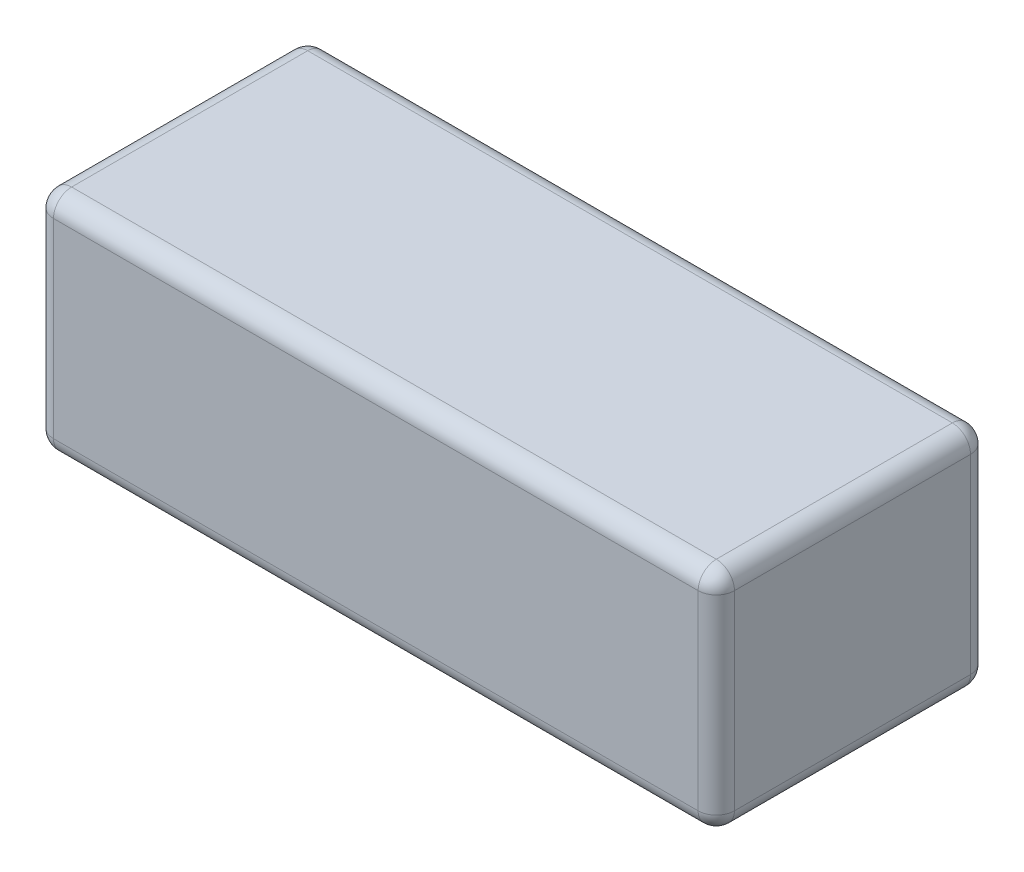
from build123d import *

# Parameters (mm, degrees)
SKETCH1_W           = 75
SKETCH1_H           = 30
BOSS_EXTRUDE1_DEPTH = 25
FILLET2_R           = 2
CUT_EXTRUDE1_DEPTH  = 1


with BuildPart() as part:
    # Sketch1 → Boss-Extrude1 (new body)
    with BuildSketch(Plane(origin=(0, 0, 0), x_dir=(1, 0, 0), z_dir=(0, 1, 0))):
        with Locations((0, -0.011554176)):
            Rectangle(SKETCH1_W, SKETCH1_H)
    extrude(amount=BOSS_EXTRUDE1_DEPTH)

    # Fillet2
    fillet2_edges = [part.edges().sort_by_distance(p)[0] for p in [
        (0, 25, -14.988445824),
        (-37.5, 12.5, -14.988445824),
        (-37.5, 25, 0.011554176),
        (0, 0, -14.988445824),
        (-37.5, 0, 0.011554176),
        (-37.5, 12.5, 15.011554176),
        (0, 25, 15.011554176),
        (0, 0, 15.011554176),
        (37.5, 12.5, 15.011554176),
        (37.5, 25, 0.011554176),
        (37.5, 12.5, -14.988445824),
        (37.5, 0, 0.011554176),
    ]]
    fillet(fillet2_edges, radius=FILLET2_R)

    # Sketch2 → Cut-Extrude1 (cut)
    # profile 1 of 14: a face of its own
    with BuildSketch(Plane.XZ):
        Polygon((-24.849242405, 0), (-17.424621202, 7.424621202), (-10, 0), (-17.424621202, -7.424621202), align=None)
    # profile 2 of 14: a face of its own
    with BuildSketch(Plane.XZ):
        with BuildLine():
            Line((-9.837179487, 3.224969952), (-9.300380609, 3.546794872))
            add(Edge.make_bspline(
                [(-9.300380609, 3.546794872), (-9.250454664, 3.463220916), (-9.154798481, 3.303096443), (-8.995229586, 3.086728284), (-8.829888448, 2.902828371), (-8.657550657, 2.752466525), (-8.479268151, 2.634086402), (-8.293877082, 2.550262353), (-8.102002197, 2.497981941), (-7.971421121, 2.491631784), (-7.906229968, 2.488461538)],
                knots=[0, 0, 0, 0, 1.272034388, 2.437168799, 3.508375237, 4.49857839, 5.41946034, 6.295179144, 7.148887113, 8, 8, 8, 8], degree=3))
            add(Edge.make_bspline(
                [(-7.906229968, 2.488461538), (-7.850555235, 2.490012159), (-7.740179947, 2.493086267), (-7.577688449, 2.522624293), (-7.419878608, 2.568003441), (-7.270002937, 2.632992846), (-7.130129464, 2.711621241), (-7.007471603, 2.806592163), (-6.901433655, 2.912920565), (-6.814694261, 3.031543381), (-6.748146197, 3.15911878), (-6.69699773, 3.290066577), (-6.668613097, 3.426443837), (-6.664337272, 3.518265676), (-6.662179487, 3.564603365)],
                knots=[0, 0, 0, 0, 1.095163259, 2.171163733, 3.241058638, 4.321873601, 5.38011039, 6.391990106, 7.366004449, 8.327778327, 9.272591725, 10.192022065, 11.087607919, 12, 12, 12, 12], degree=3))
            add(Edge.make_bspline(
                [(-6.662179487, 3.564603365), (-6.664854308, 3.617473193), (-6.670291828, 3.724949826), (-6.71625037, 3.883517768), (-6.78854829, 4.040440002), (-6.855246229, 4.137506584), (-6.889873798, 4.187900641)],
                knots=[0, 0, 0, 0, 0.938893495, 1.908633276, 2.914225137, 4, 4, 4, 4], degree=3))
            add(Edge.make_bspline(
                [(-6.889873798, 4.187900641), (-6.91830477, 4.224271307), (-6.977992038, 4.30062697), (-7.080603525, 4.414283326), (-7.201010618, 4.5315196), (-7.335092782, 4.65681246), (-7.487734243, 4.784334606), (-7.654154162, 4.920167053), (-7.838601449, 5.0591442), (-7.967959107, 5.152348712), (-8.034705529, 5.200440705)],
                knots=[0, 0, 0, 0, 0.722233717, 1.516239348, 2.393582979, 3.351407094, 4.387010283, 5.505090956, 6.712668013, 8, 8, 8, 8], degree=3))
            add(Edge.make_bspline(
                [(-8.034705529, 5.200440705), (-8.101514779, 5.248026857), (-8.229248978, 5.339007956), (-8.407880977, 5.474034871), (-8.567618789, 5.597485891), (-8.707752433, 5.71052317), (-8.828220273, 5.813162039), (-8.929971605, 5.904416871), (-9.010414415, 5.986755618), (-9.055146683, 6.040170623), (-9.075230369, 6.064152644)],
                knots=[0, 0, 0, 0, 1.452282411, 2.77665338, 3.964542531, 5.026858415, 5.96415736, 6.766646006, 7.446254459, 8, 8, 8, 8], degree=3))
            add(Edge.make_bspline(
                [(-9.075230369, 6.064152644), (-9.103301986, 6.101528811), (-9.15850859, 6.175034059), (-9.2313812, 6.289923444), (-9.293319395, 6.407531369), (-9.341873912, 6.528173866), (-9.382761052, 6.650157237), (-9.410261869, 6.775073068), (-9.427481975, 6.902360847), (-9.429245436, 6.988019627), (-9.430128205, 7.030899439)],
                knots=[0, 0, 0, 0, 1.068054152, 2.10047183, 3.106115577, 4.101338837, 5.06977816, 6.043150881, 7.020423561, 8, 8, 8, 8], degree=3))
            add(Edge.make_bspline(
                [(-9.430128205, 7.030899439), (-9.427760183, 7.09808203), (-9.423074754, 7.231011231), (-9.383449815, 7.425195738), (-9.320906137, 7.610591095), (-9.233285412, 7.785361843), (-9.120332786, 7.944957266), (-8.989620804, 8.091213164), (-8.83393425, 8.214164734), (-8.663114491, 8.321592326), (-8.476140787, 8.405677076), (-8.280214434, 8.469106283), (-8.075024032, 8.505045936), (-7.936044059, 8.510203524), (-7.86552484, 8.512820513)],
                knots=[0, 0, 0, 0, 1.005424448, 1.989358655, 2.955360095, 3.929531133, 4.905563448, 5.876582895, 6.856512386, 7.866279853, 8.892233794, 9.918561126, 10.94386622, 12, 12, 12, 12], degree=3))
            add(Edge.make_bspline(
                [(-7.86552484, 8.512820513), (-7.790696258, 8.510239598), (-7.641886091, 8.505106981), (-7.422993943, 8.460480032), (-7.212245214, 8.386637384), (-7.042712434, 8.302837962), (-6.91002871, 8.219142394), (-6.808841037, 8.142906427), (-6.706302234, 8.055140158), (-6.601585192, 7.955609812), (-6.496464281, 7.843402135), (-6.389378875, 7.719285599), (-6.280078558, 7.584018705), (-6.209764355, 7.487454254), (-6.173717949, 7.437950721)],
                knots=[0, 0, 0, 0, 1.286793592, 2.559021753, 3.825965368, 5.121522368, 5.803751409, 6.523245864, 7.299691795, 8.125521123, 9.008227632, 9.944561021, 10.946284179, 12, 12, 12, 12], degree=3))
            Line((-6.173717949, 7.437950721), (-6.688892228, 7.047435897))
            add(Edge.make_bspline(
                [(-6.688892228, 7.047435897), (-6.719999848, 7.087511093), (-6.779905851, 7.164686549), (-6.870855063, 7.272765936), (-6.95657761, 7.371492978), (-7.041033336, 7.457245424), (-7.119761781, 7.534719295), (-7.196174129, 7.601049139), (-7.269170738, 7.656884863), (-7.361185704, 7.716472464), (-7.476787851, 7.775539263), (-7.621902652, 7.825521162), (-7.773552037, 7.855556775), (-7.876838654, 7.859528042), (-7.929126603, 7.861538462)],
                knots=[0, 0, 0, 0, 1.181633172, 2.275549214, 3.290209073, 4.226197932, 5.078386478, 5.862611352, 6.581680152, 7.217281963, 8.414376989, 9.595101626, 10.782541182, 12, 12, 12, 12], degree=3))
            add(Edge.make_bspline(
                [(-7.929126603, 7.861538462), (-7.994724865, 7.859340092), (-8.121224934, 7.855100742), (-8.300821505, 7.808800198), (-8.46246334, 7.735898822), (-8.601351565, 7.633727362), (-8.716988652, 7.512676418), (-8.800637128, 7.373377638), (-8.850983855, 7.219558137), (-8.857127533, 7.112258274), (-8.86025641, 7.057612179)],
                knots=[0, 0, 0, 0, 1.14458467, 2.207223713, 3.21896685, 4.227309161, 5.202851033, 6.127160689, 7.046193047, 8, 8, 8, 8], degree=3))
            add(Edge.make_bspline(
                [(-8.86025641, 7.057612179), (-8.859543166, 7.02359164), (-8.858115512, 6.95549493), (-8.838204093, 6.854890208), (-8.812623882, 6.754539635), (-8.772087964, 6.654894377), (-8.716125771, 6.554211754), (-8.642637809, 6.450758031), (-8.550085085, 6.343621359), (-8.47918822, 6.27393941), (-8.441756811, 6.237149439)],
                knots=[0, 0, 0, 0, 0.858281714, 1.717966888, 2.583508476, 3.4729293, 4.427298488, 5.488583878, 6.674047936, 8, 8, 8, 8], degree=3))
            add(Edge.make_bspline(
                [(-8.441756811, 6.237149439), (-8.427856892, 6.224745121), (-8.394833868, 6.1952753), (-8.334461831, 6.147029305), (-8.25473704, 6.087515704), (-8.157741332, 6.013878716), (-8.041686262, 5.928459491), (-7.906559067, 5.832350224), (-7.753866, 5.722430891), (-7.645513381, 5.64558221), (-7.588221154, 5.604947917)],
                knots=[0, 0, 0, 0, 0.420754252, 0.999615792, 1.744751191, 2.668019286, 3.750313428, 4.999500688, 6.413464383, 8, 8, 8, 8], degree=3))
            add(Edge.make_bspline(
                [(-7.588221154, 5.604947917), (-7.519303854, 5.554798593), (-7.385855055, 5.457691378), (-7.195976302, 5.311794359), (-7.023811822, 5.169104836), (-6.868757153, 5.030534034), (-6.729280476, 4.897133065), (-6.606929183, 4.76729701), (-6.500456591, 4.641956042), (-6.385831438, 4.481260083), (-6.268705108, 4.283900116), (-6.168118373, 4.042095312), (-6.104693943, 3.799350559), (-6.096399908, 3.636197584), (-6.092307692, 3.555699119)],
                knots=[0, 0, 0, 0, 1.163667725, 2.253281268, 3.268753668, 4.215851969, 5.092017293, 5.902905408, 6.650798638, 7.335211899, 8.59617414, 9.77448103, 10.901945474, 12, 12, 12, 12], degree=3))
            add(Edge.make_bspline(
                [(-6.092307692, 3.555699119), (-6.093499929, 3.498769799), (-6.095861249, 3.386016689), (-6.123004621, 3.220453907), (-6.162773156, 3.059652186), (-6.222712138, 2.905599168), (-6.295869868, 2.755476527), (-6.38870006, 2.613222193), (-6.496301146, 2.475687727), (-6.619733833, 2.346540536), (-6.75479997, 2.227983866), (-6.897554674, 2.12252114), (-7.048231597, 2.034585753), (-7.206013343, 1.962829226), (-7.370936154, 1.906706987), (-7.542944562, 1.866043638), (-7.722322104, 1.841086848), (-7.844242978, 1.838496481), (-7.906229968, 1.837179487)],
                knots=[0, 0, 0, 0, 0.983748083, 1.948392443, 2.894712957, 3.844097841, 4.80183111, 5.778335162, 6.776009319, 7.81870978, 8.863265674, 9.881300176, 10.883814829, 11.87499822, 12.874611388, 13.892143829, 14.928324115, 16, 16, 16, 16], degree=3))
            add(Edge.make_bspline(
                [(-7.906229968, 1.837179487), (-7.954191233, 1.838106917), (-8.049509741, 1.839950096), (-8.190496943, 1.856244704), (-8.328635912, 1.879299021), (-8.462193253, 1.915900548), (-8.592889699, 1.960308778), (-8.720156825, 2.014988324), (-8.844056308, 2.080515246), (-8.965282494, 2.15543622), (-9.083527068, 2.242626699), (-9.19768096, 2.344178614), (-9.311489625, 2.457291173), (-9.421593902, 2.585036052), (-9.530220892, 2.725349431), (-9.635228863, 2.879544093), (-9.738791408, 3.046780149), (-9.8037709, 3.164463947), (-9.837179487, 3.224969952)],
                knots=[0, 0, 0, 0, 0.915332311, 1.819136955, 2.706846663, 3.586547465, 4.459518054, 5.340707479, 6.227863349, 7.133153174, 8.059268498, 9.028702269, 10.047606654, 11.120612155, 12.245963614, 13.433783089, 14.680604001, 16, 16, 16, 16], degree=3))
        make_face()
    # profile 3 of 14: a face of its own
    with BuildSketch(Plane.XZ):
        Polygon((-5.522435897, 7.698717949), (-5.522435897, 8.35), (-2.184615385, 8.35), (-2.184615385, 7.698717949), (-3.568589744, 7.698717949), (-3.568589744, 2), (-4.138461538, 2), (-4.138461538, 7.698717949), align=None)
    # profile 4 of 14: a face of its own
    with BuildSketch(Plane.XZ):
        Polygon((-1.533333333, 2), (-0.695062099, 8.35), (-0.613651843, 8.35), (2.008012821, 3.13974359), (4.623317308, 8.35), (4.705999599, 8.35), (5.549358974, 2), (4.976943109, 2), (4.368910256, 6.569150641), (2.076702724, 2), (1.948227163, 2), (-0.352884615, 6.579326923), (-0.959645433, 2), align=None)
    # profile 5 of 14: a face of its own
    with BuildSketch(Plane.XZ):
        with BuildLine():
            Line((7.096153846, 6.884615385), (6.526282051, 6.884615385))
            add(Edge.make_bspline(
                [(6.526282051, 6.884615385), (6.541720808, 6.948537177), (6.571902313, 7.073499053), (6.634853625, 7.25203794), (6.703432274, 7.420990615), (6.785781078, 7.577193491), (6.875604103, 7.723785786), (6.978515327, 7.857442626), (7.089766823, 7.981563292), (7.21282066, 8.091714452), (7.341868375, 8.191459761), (7.478728328, 8.276504507), (7.620647006, 8.349664042), (7.76860769, 8.409935034), (7.923050887, 8.455338484), (8.082580347, 8.488280117), (8.247614126, 8.509672567), (8.359641897, 8.51176038), (8.416526442, 8.512820513)],
                knots=[0, 0, 0, 0, 1.162005537, 2.271625781, 3.343758855, 4.383309926, 5.390229558, 6.379919256, 7.361854164, 8.333198761, 9.295911338, 10.242430842, 11.177959212, 12.116337295, 13.062827104, 14.020064771, 14.994644689, 16, 16, 16, 16], degree=3))
            add(Edge.make_bspline(
                [(8.416526442, 8.512820513), (8.499407989, 8.510318195), (8.663363194, 8.505368142), (8.904233294, 8.460166236), (9.136510523, 8.388637782), (9.357652444, 8.289806877), (9.563063029, 8.167909894), (9.745827253, 8.022831015), (9.903467837, 7.857369425), (10.035719065, 7.674611772), (10.13926942, 7.47929392), (10.215626127, 7.278270777), (10.262111176, 7.072019201), (10.268135615, 6.932759566), (10.271153846, 6.862990785)],
                knots=[0, 0, 0, 0, 1.083050992, 2.142477498, 3.193116406, 4.255571735, 5.30263384, 6.308962982, 7.297363603, 8.282367274, 9.249857812, 10.179914175, 11.08814088, 12, 12, 12, 12], degree=3))
            add(Edge.make_bspline(
                [(10.271153846, 6.862990785), (10.26904276, 6.795849886), (10.264911691, 6.664465566), (10.229834825, 6.472656564), (10.170804748, 6.291878232), (10.089035322, 6.121369552), (9.98318708, 5.962211629), (9.854966616, 5.814046369), (9.70346893, 5.676216611), (9.588662856, 5.597259853), (9.529557292, 5.556610577)],
                knots=[0, 0, 0, 0, 1.024540389, 2.004866551, 2.965041327, 3.920577974, 4.882998113, 5.874504559, 6.905732034, 8, 8, 8, 8], degree=3))
            add(Edge.make_bspline(
                [(9.529557292, 5.556610577), (9.597106332, 5.523993037), (9.730940518, 5.459368257), (9.913367908, 5.332629954), (10.078972053, 5.186296295), (10.171325943, 5.072100339), (10.217728365, 5.014723558)],
                knots=[0, 0, 0, 0, 1.015518401, 2.012035669, 3.001164323, 4, 4, 4, 4], degree=3))
            add(Edge.make_bspline(
                [(10.217728365, 5.014723558), (10.248283372, 4.972890208), (10.308893027, 4.88990856), (10.383706066, 4.756492473), (10.451576888, 4.621597628), (10.504463714, 4.48160842), (10.545419159, 4.338147381), (10.574694531, 4.190968176), (10.592881187, 4.039950621), (10.595485688, 3.937783693), (10.596794872, 3.886428285)],
                knots=[0, 0, 0, 0, 1.025084078, 2.033381695, 3.024893161, 4.013698104, 4.991890475, 5.976764909, 6.982997093, 8, 8, 8, 8], degree=3))
            add(Edge.make_bspline(
                [(10.596794872, 3.886428285), (10.593539112, 3.797510648), (10.587042913, 3.620093822), (10.528978378, 3.357975399), (10.438965784, 3.101751987), (10.311136772, 2.856687636), (10.155348577, 2.627397516), (9.970006003, 2.422244784), (9.757214948, 2.245898745), (9.519896128, 2.098560188), (9.262780766, 1.980780529), (8.987779335, 1.899033454), (8.698854237, 1.845791427), (8.500720997, 1.840082107), (8.399989984, 1.837179487)],
                knots=[0, 0, 0, 0, 0.955779014, 1.907060117, 2.875433937, 3.871313158, 4.872415639, 5.851225146, 6.836215519, 7.83643374, 8.849228613, 9.86973379, 10.916971861, 12, 12, 12, 12], degree=3))
            add(Edge.make_bspline(
                [(8.399989984, 1.837179487), (8.332100682, 1.838754674), (8.198517174, 1.841854117), (8.002132541, 1.863042436), (7.814677458, 1.90174116), (7.635898474, 1.953817157), (7.465636765, 2.019842174), (7.304411888, 2.102063241), (7.151231939, 2.198785537), (7.007542413, 2.311150761), (6.87336044, 2.436846906), (6.752251926, 2.578105396), (6.64219773, 2.732314971), (6.546144657, 2.901266802), (6.459717615, 3.082777483), (6.388632165, 3.279171187), (6.32606549, 3.488692198), (6.296976205, 3.634701813), (6.282051282, 3.709615385)],
                knots=[0, 0, 0, 0, 1.048658725, 2.063410685, 3.046034179, 4.001477787, 4.936774919, 5.862367409, 6.792675028, 7.730719943, 8.675894397, 9.627829632, 10.600096036, 11.597688215, 12.626045268, 13.701542398, 14.82072376, 16, 16, 16, 16], degree=3))
            Line((6.282051282, 3.709615385), (6.851923077, 3.709615385))
            add(Edge.make_bspline(
                [(6.851923077, 3.709615385), (6.866769906, 3.660722175), (6.895648277, 3.565620635), (6.944805075, 3.428750366), (7.00080894, 3.303277898), (7.060888211, 3.188282805), (7.123986249, 3.082632589), (7.194589041, 2.989120913), (7.267467348, 2.903640474), (7.322402746, 2.855480964), (7.349288862, 2.831911058)],
                knots=[0, 0, 0, 0, 1.198163088, 2.33053128, 3.407730985, 4.417276592, 5.372219308, 6.28897303, 7.162600585, 8, 8, 8, 8], degree=3))
            add(Edge.make_bspline(
                [(7.349288862, 2.831911058), (7.384842651, 2.804500223), (7.455840482, 2.749763166), (7.571534273, 2.679910211), (7.693209138, 2.619383779), (7.823501475, 2.573149074), (7.959599702, 2.534001033), (8.103703636, 2.508382376), (8.25454193, 2.490805266), (8.357534872, 2.489254176), (8.410166266, 2.488461538)],
                knots=[0, 0, 0, 0, 0.946170439, 1.889420265, 2.845303464, 3.807233317, 4.801018734, 5.828864929, 6.890507805, 8, 8, 8, 8], degree=3))
            add(Edge.make_bspline(
                [(8.410166266, 2.488461538), (8.469590478, 2.489578967), (8.585789395, 2.491764001), (8.755343211, 2.511858497), (8.916646723, 2.541123676), (9.067909031, 2.586322945), (9.211111523, 2.642168204), (9.344246801, 2.712287454), (9.469062594, 2.794555735), (9.58396023, 2.888062494), (9.68727565, 2.990427206), (9.778243053, 3.097493778), (9.855576367, 3.208810783), (9.917958002, 3.324994231), (9.967216858, 3.445563003), (10.000750664, 3.570855451), (10.024066985, 3.699846205), (10.025965838, 3.787528763), (10.026923077, 3.831730769)],
                knots=[0, 0, 0, 0, 1.217147791, 2.380027433, 3.494444702, 4.572153297, 5.609568379, 6.639424714, 7.649109417, 8.668170816, 9.669597737, 10.625200337, 11.543417969, 12.441394052, 13.322311151, 14.205496177, 15.095365482, 16, 16, 16, 16], degree=3))
            add(Edge.make_bspline(
                [(10.026923077, 3.831730769), (10.024146673, 3.890897055), (10.018607679, 4.008935225), (9.976319257, 4.182594252), (9.906761603, 4.349913872), (9.809384332, 4.508039377), (9.690846653, 4.654589941), (9.552298894, 4.785348202), (9.392590537, 4.893243939), (9.245597346, 4.967790501), (9.115394847, 5.018657766), (9.003969793, 5.052539487), (8.87922567, 5.081229977), (8.742671008, 5.107922241), (8.593276887, 5.130639544), (8.431205949, 5.149583981), (8.256425353, 5.164742413), (8.135428524, 5.171511685), (8.073076923, 5.175)],
                knots=[0, 0, 0, 0, 1.07054697, 2.135767047, 3.216561865, 4.33974944, 5.486079747, 6.621378074, 7.775625952, 8.963672916, 9.598146892, 10.304877434, 11.070270905, 11.915000392, 12.823868403, 13.805723172, 14.86925407, 16, 16, 16, 16], degree=3))
            Line((8.073076923, 5.175), (8.073076923, 5.826282051))
            add(Edge.make_bspline(
                [(8.073076923, 5.826282051), (8.151637609, 5.827615195), (8.305518695, 5.830226497), (8.530298363, 5.861809601), (8.7452428, 5.905498741), (8.945588461, 5.972419018), (9.128193984, 6.050143557), (9.28661669, 6.140589708), (9.418637086, 6.241127896), (9.523613601, 6.353309916), (9.602588059, 6.473624359), (9.660330963, 6.599021724), (9.694440126, 6.730601092), (9.698993379, 6.820398561), (9.701282051, 6.865534856)],
                knots=[0, 0, 0, 0, 1.321986639, 2.589447074, 3.816329219, 5.01088745, 6.139805852, 7.153945165, 8.075214402, 8.924034688, 9.728124013, 10.488707548, 11.240355623, 12, 12, 12, 12], degree=3))
            add(Edge.make_bspline(
                [(9.701282051, 6.865534856), (9.700530191, 6.898695908), (9.699034402, 6.964668248), (9.680170769, 7.061052301), (9.651824295, 7.154489731), (9.612853929, 7.244583187), (9.560692854, 7.330707827), (9.498270564, 7.413597913), (9.423942725, 7.492780198), (9.338770271, 7.56658592), (9.247308854, 7.636924393), (9.147069976, 7.696639135), (9.041076003, 7.747702319), (8.929209587, 7.789810987), (8.811107696, 7.821487124), (8.687325227, 7.844230722), (8.557626144, 7.858450467), (8.469140288, 7.860497736), (8.424158654, 7.861538462)],
                knots=[0, 0, 0, 0, 0.884392785, 1.759457502, 2.611959086, 3.489218968, 4.37281399, 5.2945488, 6.255912374, 7.266815255, 8.301784654, 9.332968512, 10.37626691, 11.440494194, 12.520033166, 13.637162961, 14.798855837, 16, 16, 16, 16], degree=3))
            add(Edge.make_bspline(
                [(8.424158654, 7.861538462), (8.351856342, 7.859014133), (8.21063311, 7.854083533), (8.00704319, 7.810898066), (7.817778112, 7.741994972), (7.673109389, 7.659747922), (7.566279576, 7.578557849), (7.489939988, 7.507651234), (7.414972776, 7.428851682), (7.346309905, 7.337305773), (7.276869976, 7.239213168), (7.213651986, 7.129587346), (7.15222083, 7.011287945), (7.115204776, 6.927657293), (7.096153846, 6.884615385)],
                knots=[0, 0, 0, 0, 1.472543308, 2.876219568, 4.221790263, 5.565193594, 6.249813518, 6.953379497, 7.687249741, 8.463570142, 9.283606569, 10.136032583, 11.040678096, 12, 12, 12, 12], degree=3))
        make_face()
    # profile 6 of 14: a face of its own
    with BuildSketch(Plane.XZ):
        with BuildLine():
            Line((11.980769231, 6.396153846), (11.410897436, 6.396153846))
            add(Edge.make_bspline(
                [(11.410897436, 6.396153846), (11.414611556, 6.471756743), (11.42190599, 6.620238819), (11.456065886, 6.836726478), (11.504944335, 7.04365447), (11.574053116, 7.239361314), (11.65988022, 7.425577435), (11.762804698, 7.601563178), (11.884713541, 7.766647192), (12.02297433, 7.919299093), (12.173140289, 8.0593394), (12.33516678, 8.180271055), (12.505428472, 8.282447402), (12.68340881, 8.367866226), (12.871115833, 8.431982804), (13.06684616, 8.47955635), (13.271459736, 8.508179149), (13.410869491, 8.511255788), (13.481770833, 8.512820513)],
                knots=[0, 0, 0, 0, 1.10065271, 2.161652631, 3.183658789, 4.190468796, 5.17591951, 6.163126047, 7.15150782, 8.156236427, 9.156009102, 10.134482811, 11.092018607, 12.041330605, 13.001268258, 13.972401359, 14.968799086, 16, 16, 16, 16], degree=3))
            add(Edge.make_bspline(
                [(13.481770833, 8.512820513), (13.551399625, 8.511190456), (13.688217713, 8.507987453), (13.887901654, 8.480481014), (14.077997602, 8.437399726), (14.258133978, 8.376956043), (14.426873553, 8.295704296), (14.585483934, 8.19810019), (14.735853405, 8.085215639), (14.871211426, 7.952312291), (14.995504656, 7.810430822), (15.102733033, 7.658959912), (15.194559772, 7.50251535), (15.271100277, 7.339904185), (15.327444987, 7.169595319), (15.370222593, 6.994068251), (15.394402329, 6.811506094), (15.398113311, 6.687941343), (15.4, 6.625120192)],
                knots=[0, 0, 0, 0, 1.111607364, 2.184268762, 3.212621178, 4.221274766, 5.211760367, 6.196651075, 7.1921475, 8.207485113, 9.220403448, 10.201281604, 11.166441695, 12.114753415, 13.065576456, 14.026450734, 14.996634279, 16, 16, 16, 16], degree=3))
            add(Edge.make_bspline(
                [(15.4, 6.625120192), (15.396927937, 6.536677692), (15.390837723, 6.361344733), (15.338741639, 6.103689197), (15.257377255, 5.854055422), (15.159410622, 5.653146317), (15.060582045, 5.491251264), (14.971523281, 5.357958042), (14.867265695, 5.214438121), (14.746291849, 5.061172094), (14.611104209, 4.896959452), (14.460478284, 4.721899395), (14.293339967, 4.537800613), (14.176030973, 4.41206045), (14.115244391, 4.346905048)],
                knots=[0, 0, 0, 0, 1.184426356, 2.348067706, 3.509069118, 4.696110526, 5.333549288, 6.050745305, 6.844228056, 7.710549037, 8.667450064, 9.695053472, 10.805634456, 12, 12, 12, 12], degree=3))
            Line((14.115244391, 4.346905048), (12.526472356, 2.651282051))
            Line((12.526472356, 2.651282051), (15.481410256, 2.651282051))
            Line((15.481410256, 2.651282051), (15.481410256, 2))
            Line((15.481410256, 2), (11.166666667, 2))
            Line((11.166666667, 2), (13.629326923, 4.62802484))
            add(Edge.make_bspline(
                [(13.629326923, 4.62802484), (13.689285232, 4.690614624), (13.804452873, 4.810836792), (13.967344119, 4.986356162), (14.113646284, 5.149187472), (14.244306411, 5.299023067), (14.356490056, 5.438054626), (14.456043963, 5.561779302), (14.535810106, 5.675633805), (14.622379467, 5.807606061), (14.706224833, 5.96873698), (14.778274393, 6.165648102), (14.822207047, 6.36835326), (14.827477249, 6.505335527), (14.830128205, 6.574238782)],
                knots=[0, 0, 0, 0, 1.329631726, 2.553950428, 3.673215718, 4.687767853, 5.603093632, 6.413772471, 7.123043292, 7.734684054, 8.834405432, 9.900288307, 10.943827018, 12, 12, 12, 12], degree=3))
            add(Edge.make_bspline(
                [(14.830128205, 6.574238782), (14.828974787, 6.617566462), (14.826701621, 6.702956999), (14.806639799, 6.828153162), (14.776322166, 6.948920753), (14.732878627, 7.065631247), (14.67553497, 7.177111216), (14.605733266, 7.283496359), (14.525197008, 7.386346338), (14.432031134, 7.482781608), (14.329684519, 7.571103223), (14.221563524, 7.649342636), (14.10717262, 7.714727879), (13.986994113, 7.768328224), (13.861363047, 7.810374987), (13.730036438, 7.839509839), (13.593377151, 7.857802345), (13.500062095, 7.860277343), (13.452514022, 7.861538462)],
                knots=[0, 0, 0, 0, 0.991446411, 1.95395049, 2.89581595, 3.838931463, 4.798493298, 5.75982156, 6.748411868, 7.785213223, 8.824556874, 9.840280684, 10.836137867, 11.835679398, 12.848801643, 13.863922112, 14.911575587, 16, 16, 16, 16], degree=3))
            add(Edge.make_bspline(
                [(13.452514022, 7.861538462), (13.402855512, 7.860241189), (13.305334396, 7.857693559), (13.162152722, 7.83987244), (13.025562811, 7.809127844), (12.895221073, 7.767078735), (12.770906967, 7.71363251), (12.653225059, 7.647063202), (12.542439531, 7.567627436), (12.438342124, 7.477565284), (12.342431762, 7.377294065), (12.258163859, 7.265515989), (12.184532862, 7.144271964), (12.120290395, 7.013889136), (12.068119358, 6.873184421), (12.028253785, 6.722657299), (11.996709077, 6.562961365), (11.986170761, 6.452679853), (11.980769231, 6.396153846)],
                knots=[0, 0, 0, 0, 1.031018746, 2.02475058, 2.990194455, 3.934040569, 4.864654155, 5.795059489, 6.735614925, 7.690564532, 8.649604399, 9.611025574, 10.590972636, 11.591080095, 12.624614302, 13.701020113, 14.821632451, 16, 16, 16, 16], degree=3))
        make_face()
    # profile 7 of 14: a face of its own
    with BuildSketch(Plane.XZ):
        Polygon((16.621153846, 8.35), (19.71474359, 8.35), (19.71474359, 7.698717949), (17.191025641, 7.698717949), (17.191025641, 5.744871795), (19.71474359, 5.744871795), (19.71474359, 5.093589744), (17.191025641, 5.093589744), (17.191025641, 2), (16.621153846, 2), align=None)
    # profile 8 of 14: a face of its own
    with BuildSketch(Plane.XZ):
        Polygon((21.634244792, 8.35), (22.808333333, 8.35), (22.808333333, 2), (22.238461538, 2), (22.238461538, 7.698717949), (21.261538462, 7.698717949), align=None)
    # profile 9 of 14: a face of its own
    with BuildSketch(Plane.XZ):
        with BuildLine():
            add(Edge.make_bspline(
                [(25.169230769, 5.172455929), (25.169825888, 5.274232619), (25.170981914, 5.471935304), (25.183842335, 5.760016012), (25.205206171, 6.030272536), (25.234483976, 6.282717813), (25.270112883, 6.517417015), (25.317675265, 6.733742931), (25.371764207, 6.932696789), (25.434452216, 7.114927363), (25.505187205, 7.282889767), (25.582175078, 7.439689775), (25.668471205, 7.585090138), (25.759143604, 7.721411557), (25.857862648, 7.846422547), (25.961819025, 7.96188852), (26.075070144, 8.065140882), (26.193766173, 8.159204887), (26.318981758, 8.241663215), (26.447147738, 8.31429404), (26.579146288, 8.376342371), (26.715337791, 8.425129305), (26.854498146, 8.465426127), (26.997113824, 8.492983217), (27.143420299, 8.51032218), (27.242174473, 8.511979834), (27.292257612, 8.512820513)],
                knots=[0, 0, 0, 0, 1.646270934, 3.197905019, 4.663502075, 6.030701355, 7.308322542, 8.50163776, 9.611534131, 10.641858119, 11.616356847, 12.558055219, 13.465016945, 14.349605745, 15.204443733, 16.039544428, 16.859896111, 17.680448484, 18.487036065, 19.28249412, 20.06191084, 20.843045899, 21.620316918, 22.403196591, 23.190181807, 24, 24, 24, 24], degree=3))
            add(Edge.make_bspline(
                [(27.292257612, 8.512820513), (27.342759123, 8.511935477), (27.443190739, 8.510175418), (27.591672563, 8.493259123), (27.736724128, 8.465190085), (27.877727037, 8.425419174), (28.015839513, 8.376078446), (28.149981281, 8.314234677), (28.280985557, 8.242245875), (28.406770508, 8.15765684), (28.528717024, 8.063346139), (28.643829757, 7.956733868), (28.752119184, 7.838896521), (28.854944381, 7.711094853), (28.949388107, 7.570877628), (29.039328477, 7.4206836), (29.119832028, 7.257886174), (29.197364939, 7.085201611), (29.264288472, 6.89785183), (29.324642946, 6.696892907), (29.373409074, 6.479951168), (29.414029611, 6.248164837), (29.445498208, 6.000682689), (29.46841743, 5.738035231), (29.480524313, 5.460049665), (29.482804328, 5.269988996), (29.483974359, 5.172455929)],
                knots=[0, 0, 0, 0, 0.810914788, 1.612654377, 2.396697861, 3.181598691, 3.963628158, 4.749916497, 5.551656086, 6.361998678, 7.18212741, 8.025565596, 8.878627764, 9.750805457, 10.657531673, 11.591944965, 12.560506719, 13.57287815, 14.630710178, 15.753379473, 16.941251878, 18.199788006, 19.531962791, 20.947069417, 22.433333509, 24, 24, 24, 24], degree=3))
            add(Edge.make_bspline(
                [(29.483974359, 5.172455929), (29.482792198, 5.075348268), (29.480488807, 4.88613795), (29.468553153, 4.60940318), (29.445042494, 4.348149587), (29.415632944, 4.101750605), (29.374900482, 3.871231783), (29.324816823, 3.655795426), (29.269208381, 3.454511182), (29.200565254, 3.269028024), (29.125434394, 3.096758469), (29.043691395, 2.935890929), (28.956116139, 2.785003512), (28.86070513, 2.645303971), (28.759008224, 2.515802693), (28.648848807, 2.398785578), (28.533332174, 2.291433073), (28.411026791, 2.195907978), (28.283280119, 2.112296975), (28.152725794, 2.037523275), (28.01704737, 1.977229671), (27.879319584, 1.925458954), (27.737572406, 1.885906705), (27.591982525, 1.858558425), (27.443290497, 1.839378071), (27.342776229, 1.837914886), (27.292257612, 1.837179487)],
                knots=[0, 0, 0, 0, 1.561518951, 3.042555995, 4.452378317, 5.7783523, 7.031515105, 8.214008947, 9.334062868, 10.386615937, 11.391082383, 12.354592575, 13.286541444, 14.194233754, 15.072674879, 15.931287219, 16.775624067, 17.606195743, 18.42308326, 19.229000347, 20.022332153, 20.807536673, 21.593273796, 22.3848459, 23.188221202, 24, 24, 24, 24], degree=3))
            add(Edge.make_bspline(
                [(27.292257612, 1.837179487), (27.242175863, 1.838025589), (27.143424428, 1.839693937), (26.997097884, 1.856954564), (26.855071165, 1.884704977), (26.716643426, 1.923560816), (26.581104463, 1.971122019), (26.4503012, 2.03308656), (26.32277926, 2.104449799), (26.198878865, 2.185721492), (26.08092823, 2.278833689), (25.968263618, 2.381820327), (25.863715369, 2.497251373), (25.766407795, 2.623304176), (25.673926235, 2.758819059), (25.588855515, 2.90564625), (25.510168394, 3.063203557), (25.438243775, 3.23250891), (25.374474057, 3.41603285), (25.318144644, 3.615874931), (25.273668958, 3.833799014), (25.235599882, 4.068054809), (25.204894216, 4.319648939), (25.183931368, 4.588717994), (25.170974982, 4.875094302), (25.169822783, 5.071526607), (25.169230769, 5.172455929)],
                knots=[0, 0, 0, 0, 0.810891512, 1.598919785, 2.382837074, 3.152667961, 3.926044502, 4.706494248, 5.493654104, 6.291793342, 7.103789334, 7.925228297, 8.761435821, 9.622817696, 10.50288917, 11.416980706, 12.369136599, 13.353924996, 14.394355917, 15.514179734, 16.714354668, 17.994756427, 19.357759367, 20.818452758, 22.365282078, 24, 24, 24, 24], degree=3))
        make_face()
        with BuildLine():
            add(Edge.make_bspline(
                [(25.739102564, 5.175), (25.739319275, 5.090184504), (25.739739869, 4.925574279), (25.750727547, 4.686372935), (25.765695825, 4.463269624), (25.785002179, 4.255981065), (25.813673242, 4.065208899), (25.845798415, 3.889641046), (25.884892806, 3.73020663), (25.931148052, 3.585811602), (25.983833271, 3.454005435), (26.041356767, 3.331357516), (26.10315265, 3.216419002), (26.17231168, 3.110222313), (26.247631866, 3.01242113), (26.327411922, 2.921284419), (26.414629325, 2.840009896), (26.535286115, 2.742534031), (26.694574004, 2.641806459), (26.895271116, 2.554092839), (27.101498162, 2.498970383), (27.241472573, 2.491960425), (27.311338141, 2.488461538)],
                knots=[0, 0, 0, 0, 1.459021318, 2.831673884, 4.118529203, 5.306027144, 6.411944654, 7.436330062, 8.375795394, 9.233974572, 10.042671642, 10.816086306, 11.563610507, 12.285937304, 12.993564865, 13.685989202, 14.367179055, 15.041617293, 16.353048772, 17.594441528, 18.799311195, 20, 20, 20, 20], degree=3))
            add(Edge.make_bspline(
                [(27.311338141, 2.488461538), (27.381655631, 2.491360369), (27.522145432, 2.497152046), (27.72740246, 2.553029755), (27.92666595, 2.637338777), (28.082825042, 2.737029251), (28.201629085, 2.831967792), (28.28674991, 2.912911511), (28.364876769, 3.003545727), (28.438975962, 3.10133445), (28.506937428, 3.208145957), (28.568737692, 3.323466629), (28.625131765, 3.447616709), (28.657261034, 3.534284664), (28.673687901, 3.578595753)],
                knots=[0, 0, 0, 0, 1.353760809, 2.704726607, 4.075137775, 5.516104923, 6.260822281, 7.007110065, 7.778089737, 8.566572457, 9.372053459, 10.217411131, 11.088608312, 12, 12, 12, 12], degree=3))
            add(Edge.make_bspline(
                [(28.673687901, 3.578595753), (28.692831822, 3.635255423), (28.731702193, 3.750298853), (28.781797841, 3.928758622), (28.821250208, 4.115997922), (28.856743743, 4.310897776), (28.880970001, 4.51489552), (28.900469605, 4.727359959), (28.91195528, 4.948451288), (28.913379043, 5.098665057), (28.914102564, 5.175)],
                knots=[0, 0, 0, 0, 0.884706709, 1.796334032, 2.740027952, 3.714592787, 4.726048262, 5.777819803, 6.87074269, 8, 8, 8, 8], degree=3))
            add(Edge.make_bspline(
                [(28.914102564, 5.175), (28.913104364, 5.251322596), (28.91115167, 5.400625909), (28.903687721, 5.619280323), (28.884413522, 5.826957546), (28.863006549, 6.024552261), (28.831443019, 6.210970667), (28.797410998, 6.387773364), (28.751688799, 6.552769994), (28.702848635, 6.708543807), (28.646949775, 6.853324994), (28.585416943, 6.987788578), (28.519700323, 7.112583722), (28.448322259, 7.22736803), (28.372130091, 7.332655644), (28.289112823, 7.426335551), (28.202563461, 7.511311193), (28.081337995, 7.608307568), (27.922634641, 7.707207359), (27.725157538, 7.79822238), (27.519652226, 7.850488854), (27.380726102, 7.857857915), (27.311338141, 7.861538462)],
                knots=[0, 0, 0, 0, 1.31362396, 2.569729283, 3.763502607, 4.902122613, 5.988968491, 7.01645872, 7.998833611, 8.933434873, 9.825090667, 10.667526885, 11.477055099, 12.250526234, 12.991942729, 13.710640831, 14.402115721, 15.076753259, 16.378508321, 17.609869233, 18.806226677, 20, 20, 20, 20], degree=3))
            add(Edge.make_bspline(
                [(27.311338141, 7.861538462), (27.241106067, 7.857852837), (27.100513972, 7.850474873), (26.892872683, 7.798417113), (26.693837645, 7.707679304), (26.535553962, 7.607979999), (26.41424395, 7.513023349), (26.328822492, 7.430679353), (26.248728722, 7.340606863), (26.174945895, 7.241906246), (26.105841052, 7.135833366), (26.042375501, 7.02155375), (25.98519406, 6.898488274), (25.932426402, 6.766741313), (25.886030058, 6.622358742), (25.847759581, 6.463120711), (25.812404499, 6.288111279), (25.78737594, 6.096305886), (25.765125983, 5.888965408), (25.750826966, 5.66530513), (25.739703113, 5.425702612), (25.739306757, 5.260241281), (25.739102564, 5.175)],
                knots=[0, 0, 0, 0, 1.207732386, 2.417664972, 3.655092373, 4.956220595, 5.625982001, 6.301752483, 6.994047911, 7.697131622, 8.419323945, 9.170223765, 9.943494443, 10.752040957, 11.610060368, 12.549350801, 13.567764191, 14.679664412, 15.874934091, 17.154273443, 18.533957287, 20, 20, 20, 20], degree=3))
        make_face(mode=Mode.SUBTRACT)
    # profile 10 of 14: a face of its own
    with BuildSketch(Plane.XZ):
        with BuildLine():
            Line((30.867948718, 6.884615385), (30.298076923, 6.884615385))
            add(Edge.make_bspline(
                [(30.298076923, 6.884615385), (30.313515679, 6.948537177), (30.343697185, 7.073499053), (30.406648497, 7.25203794), (30.475227146, 7.420990615), (30.55757595, 7.577193491), (30.647398975, 7.723785786), (30.750310198, 7.857442626), (30.861561695, 7.981563292), (30.984615532, 8.091714452), (31.113663246, 8.191459761), (31.250523199, 8.276504507), (31.392441878, 8.349664042), (31.540402562, 8.409935034), (31.694845759, 8.455338484), (31.854375219, 8.488280117), (32.019408997, 8.509672567), (32.131436769, 8.51176038), (32.188321314, 8.512820513)],
                knots=[0, 0, 0, 0, 1.162005537, 2.271625781, 3.343758855, 4.383309926, 5.390229558, 6.379919256, 7.361854164, 8.333198761, 9.295911338, 10.242430842, 11.177959212, 12.116337295, 13.062827104, 14.020064771, 14.994644689, 16, 16, 16, 16], degree=3))
            add(Edge.make_bspline(
                [(32.188321314, 8.512820513), (32.27120286, 8.510318195), (32.435158066, 8.505368142), (32.676028165, 8.460166236), (32.908305394, 8.388637782), (33.129447315, 8.289806877), (33.3348579, 8.167909894), (33.517622125, 8.022831015), (33.675262709, 7.857369425), (33.807513937, 7.674611772), (33.911064292, 7.47929392), (33.987420998, 7.278270777), (34.033906048, 7.072019201), (34.039930487, 6.932759566), (34.042948718, 6.862990785)],
                knots=[0, 0, 0, 0, 1.083050992, 2.142477498, 3.193116406, 4.255571735, 5.30263384, 6.308962982, 7.297363603, 8.282367274, 9.249857812, 10.179914175, 11.08814088, 12, 12, 12, 12], degree=3))
            add(Edge.make_bspline(
                [(34.042948718, 6.862990785), (34.040837631, 6.795849886), (34.036706562, 6.664465566), (34.001629697, 6.472656564), (33.94259962, 6.291878232), (33.860830193, 6.121369552), (33.754981952, 5.962211629), (33.626761488, 5.814046369), (33.475263801, 5.676216611), (33.360457728, 5.597259853), (33.301352163, 5.556610577)],
                knots=[0, 0, 0, 0, 1.024540389, 2.004866551, 2.965041327, 3.920577974, 4.882998113, 5.874504559, 6.905732034, 8, 8, 8, 8], degree=3))
            add(Edge.make_bspline(
                [(33.301352163, 5.556610577), (33.368901204, 5.523993037), (33.50273539, 5.459368257), (33.685162779, 5.332629954), (33.850766925, 5.186296295), (33.943120815, 5.072100339), (33.989523237, 5.014723558)],
                knots=[0, 0, 0, 0, 1.015518401, 2.012035669, 3.001164323, 4, 4, 4, 4], degree=3))
            add(Edge.make_bspline(
                [(33.989523237, 5.014723558), (34.020078244, 4.972890208), (34.080687898, 4.88990856), (34.155500938, 4.756492473), (34.22337176, 4.621597628), (34.276258586, 4.48160842), (34.31721403, 4.338147381), (34.346489403, 4.190968176), (34.364676059, 4.039950621), (34.36728056, 3.937783693), (34.368589744, 3.886428285)],
                knots=[0, 0, 0, 0, 1.025084078, 2.033381695, 3.024893161, 4.013698104, 4.991890475, 5.976764909, 6.982997093, 8, 8, 8, 8], degree=3))
            add(Edge.make_bspline(
                [(34.368589744, 3.886428285), (34.365333983, 3.797510648), (34.358837785, 3.620093822), (34.30077325, 3.357975399), (34.210760656, 3.101751987), (34.082931643, 2.856687636), (33.927143449, 2.627397516), (33.741800875, 2.422244784), (33.52900982, 2.245898745), (33.291691, 2.098560188), (33.034575638, 1.980780529), (32.759574207, 1.899033454), (32.470649109, 1.845791427), (32.272515869, 1.840082107), (32.171784856, 1.837179487)],
                knots=[0, 0, 0, 0, 0.955779014, 1.907060117, 2.875433937, 3.871313158, 4.872415639, 5.851225146, 6.836215519, 7.83643374, 8.849228613, 9.86973379, 10.916971861, 12, 12, 12, 12], degree=3))
            add(Edge.make_bspline(
                [(32.171784856, 1.837179487), (32.103895554, 1.838754674), (31.970312046, 1.841854117), (31.773927413, 1.863042436), (31.58647233, 1.90174116), (31.407693345, 1.953817157), (31.237431637, 2.019842174), (31.07620676, 2.102063241), (30.92302681, 2.198785537), (30.779337285, 2.311150761), (30.645155312, 2.436846906), (30.524046798, 2.578105396), (30.413992602, 2.732314971), (30.317939529, 2.901266802), (30.231512486, 3.082777483), (30.160427037, 3.279171187), (30.097860362, 3.488692198), (30.068771077, 3.634701813), (30.053846154, 3.709615385)],
                knots=[0, 0, 0, 0, 1.048658725, 2.063410685, 3.046034179, 4.001477787, 4.936774919, 5.862367409, 6.792675028, 7.730719943, 8.675894397, 9.627829632, 10.600096036, 11.597688215, 12.626045268, 13.701542398, 14.82072376, 16, 16, 16, 16], degree=3))
            Line((30.053846154, 3.709615385), (30.623717949, 3.709615385))
            add(Edge.make_bspline(
                [(30.623717949, 3.709615385), (30.638564777, 3.660722175), (30.667443149, 3.565620635), (30.716599947, 3.428750366), (30.772603812, 3.303277898), (30.832683083, 3.188282805), (30.89578112, 3.082632589), (30.966383913, 2.989120913), (31.039262219, 2.903640474), (31.094197618, 2.855480964), (31.121083734, 2.831911058)],
                knots=[0, 0, 0, 0, 1.198163088, 2.33053128, 3.407730985, 4.417276592, 5.372219308, 6.28897303, 7.162600585, 8, 8, 8, 8], degree=3))
            add(Edge.make_bspline(
                [(31.121083734, 2.831911058), (31.156637523, 2.804500223), (31.227635354, 2.749763166), (31.343329145, 2.679910211), (31.46500401, 2.619383779), (31.595296347, 2.573149074), (31.731394573, 2.534001033), (31.875498507, 2.508382376), (32.026336801, 2.490805266), (32.129329744, 2.489254176), (32.181961138, 2.488461538)],
                knots=[0, 0, 0, 0, 0.946170439, 1.889420265, 2.845303464, 3.807233317, 4.801018734, 5.828864929, 6.890507805, 8, 8, 8, 8], degree=3))
            add(Edge.make_bspline(
                [(32.181961138, 2.488461538), (32.24138535, 2.489578967), (32.357584266, 2.491764001), (32.527138083, 2.511858497), (32.688441595, 2.541123676), (32.839703903, 2.586322945), (32.982906395, 2.642168204), (33.116041673, 2.712287454), (33.240857466, 2.794555735), (33.355755101, 2.888062494), (33.459070522, 2.990427206), (33.550037925, 3.097493778), (33.627371239, 3.208810783), (33.689752874, 3.324994231), (33.739011729, 3.445563003), (33.772545536, 3.570855451), (33.795861857, 3.699846205), (33.79776071, 3.787528763), (33.798717949, 3.831730769)],
                knots=[0, 0, 0, 0, 1.217147791, 2.380027433, 3.494444702, 4.572153297, 5.609568379, 6.639424714, 7.649109417, 8.668170816, 9.669597737, 10.625200337, 11.543417969, 12.441394052, 13.322311151, 14.205496177, 15.095365482, 16, 16, 16, 16], degree=3))
            add(Edge.make_bspline(
                [(33.798717949, 3.831730769), (33.795941545, 3.890897055), (33.790402551, 4.008935225), (33.748114128, 4.182594252), (33.678556475, 4.349913872), (33.581179204, 4.508039377), (33.462641525, 4.654589941), (33.324093766, 4.785348202), (33.164385408, 4.893243939), (33.017392217, 4.967790501), (32.887189719, 5.018657766), (32.775764665, 5.052539487), (32.651020541, 5.081229977), (32.51446588, 5.107922241), (32.365071759, 5.130639544), (32.203000821, 5.149583981), (32.028220225, 5.164742413), (31.907223395, 5.171511685), (31.844871795, 5.175)],
                knots=[0, 0, 0, 0, 1.07054697, 2.135767047, 3.216561865, 4.33974944, 5.486079747, 6.621378074, 7.775625952, 8.963672916, 9.598146892, 10.304877434, 11.070270905, 11.915000392, 12.823868403, 13.805723172, 14.86925407, 16, 16, 16, 16], degree=3))
            Line((31.844871795, 5.175), (31.844871795, 5.826282051))
            add(Edge.make_bspline(
                [(31.844871795, 5.826282051), (31.923432481, 5.827615195), (32.077313567, 5.830226497), (32.302093234, 5.861809601), (32.517037672, 5.905498741), (32.717383333, 5.972419018), (32.899988855, 6.050143557), (33.058411562, 6.140589708), (33.190431958, 6.241127896), (33.295408473, 6.353309916), (33.374382931, 6.473624359), (33.432125835, 6.599021724), (33.466234998, 6.730601092), (33.470788251, 6.820398561), (33.473076923, 6.865534856)],
                knots=[0, 0, 0, 0, 1.321986639, 2.589447074, 3.816329219, 5.01088745, 6.139805852, 7.153945165, 8.075214402, 8.924034688, 9.728124013, 10.488707548, 11.240355623, 12, 12, 12, 12], degree=3))
            add(Edge.make_bspline(
                [(33.473076923, 6.865534856), (33.472325063, 6.898695908), (33.470829274, 6.964668248), (33.451965641, 7.061052301), (33.423619167, 7.154489731), (33.384648801, 7.244583187), (33.332487726, 7.330707827), (33.270065436, 7.413597913), (33.195737597, 7.492780198), (33.110565143, 7.56658592), (33.019103726, 7.636924393), (32.918864848, 7.696639135), (32.812870875, 7.747702319), (32.701004459, 7.789810987), (32.582902568, 7.821487124), (32.459120099, 7.844230722), (32.329421016, 7.858450467), (32.240935159, 7.860497736), (32.195953526, 7.861538462)],
                knots=[0, 0, 0, 0, 0.884392785, 1.759457502, 2.611959086, 3.489218968, 4.37281399, 5.2945488, 6.255912374, 7.266815255, 8.301784654, 9.332968512, 10.37626691, 11.440494194, 12.520033166, 13.637162961, 14.798855837, 16, 16, 16, 16], degree=3))
            add(Edge.make_bspline(
                [(32.195953526, 7.861538462), (32.123651214, 7.859014133), (31.982427982, 7.854083533), (31.778838062, 7.810898066), (31.589572984, 7.741994972), (31.444904261, 7.659747922), (31.338074447, 7.578557849), (31.26173486, 7.507651234), (31.186767648, 7.428851682), (31.118104777, 7.337305773), (31.048664848, 7.239213168), (30.985446858, 7.129587346), (30.924015702, 7.011287945), (30.886999647, 6.927657293), (30.867948718, 6.884615385)],
                knots=[0, 0, 0, 0, 1.472543308, 2.876219568, 4.221790263, 5.565193594, 6.249813518, 6.953379497, 7.687249741, 8.463570142, 9.283606569, 10.136032583, 11.040678096, 12, 12, 12, 12], degree=3))
        make_face()
    # profile 11 of 14: a face of its own
    with BuildSketch(Plane.XZ):
        with BuildLine():
            Line((-3.324358974, -4.398517628), (-3.822996795, -4.780128205))
            add(Edge.make_bspline(
                [(-3.822996795, -4.780128205), (-3.858567478, -4.73773566), (-3.929229274, -4.653522113), (-4.04291097, -4.535267796), (-4.161386808, -4.424477965), (-4.2846115, -4.32062484), (-4.414803045, -4.227340137), (-4.548807637, -4.139762564), (-4.688866947, -4.061262526), (-4.882545095, -3.966079679), (-5.135906191, -3.866754512), (-5.454848256, -3.783472936), (-5.78778982, -3.730457374), (-6.014934037, -3.724715447), (-6.13046875, -3.721794872)],
                knots=[0, 0, 0, 0, 0.757959112, 1.505699292, 2.245454638, 2.979532153, 3.711538275, 4.438200793, 5.171680507, 5.909471876, 7.393775596, 8.890124382, 10.418191784, 12, 12, 12, 12], degree=3))
            add(Edge.make_bspline(
                [(-6.13046875, -3.721794872), (-6.194119879, -3.722527775), (-6.320831394, -3.72398678), (-6.508879339, -3.743234764), (-6.693415874, -3.77028796), (-6.874320963, -3.810429618), (-7.051364331, -3.861179941), (-7.225703403, -3.921823192), (-7.394814063, -3.996852687), (-7.561035723, -4.07978053), (-7.720292292, -4.173447465), (-7.870977879, -4.275615975), (-8.012542906, -4.385142764), (-8.14509936, -4.502438343), (-8.268782751, -4.626974471), (-8.382696873, -4.760078348), (-8.486447545, -4.901324435), (-8.582091291, -5.048850188), (-8.667748679, -5.202225896), (-8.739467174, -5.362019238), (-8.802976467, -5.525493825), (-8.853230807, -5.694496645), (-8.893008145, -5.867838521), (-8.920454048, -6.045984664), (-8.939483132, -6.228562912), (-8.940934881, -6.352314093), (-8.941666667, -6.41469351)],
                knots=[0, 0, 0, 0, 1.054917814, 2.100044995, 3.131103042, 4.146048494, 5.169673617, 6.183595914, 7.203665975, 8.234915748, 9.262203917, 10.264457458, 11.251630812, 12.227803204, 13.197192746, 14.159520551, 15.12972552, 16.100847026, 17.073214652, 18.039054194, 19.002613845, 19.979014051, 20.95965708, 21.949030935, 22.966165397, 24, 24, 24, 24], degree=3))
            add(Edge.make_bspline(
                [(-8.941666667, -6.41469351), (-8.939377366, -6.508548904), (-8.934882629, -6.692821523), (-8.894880652, -6.962733916), (-8.834092843, -7.221307138), (-8.742987439, -7.466924852), (-8.63064859, -7.70261573), (-8.488697767, -7.924391936), (-8.324293477, -8.135604846), (-8.135109888, -8.331262765), (-7.92754505, -8.50999481), (-7.704845268, -8.667385151), (-7.467565203, -8.798585009), (-7.218324745, -8.907761369), (-6.955205938, -8.991684289), (-6.67868194, -9.050764913), (-6.389354177, -9.089304298), (-6.191652551, -9.092993989), (-6.091035657, -9.094871795)],
                knots=[0, 0, 0, 0, 1.029171465, 2.020641659, 2.987623507, 3.938342917, 4.889210282, 5.84687017, 6.821220943, 7.821438502, 8.827599549, 9.822697543, 10.807740252, 11.797342354, 12.80366471, 13.83203677, 14.896651826, 16, 16, 16, 16], degree=3))
            add(Edge.make_bspline(
                [(-6.091035657, -9.094871795), (-5.980177921, -9.091807866), (-5.761983378, -9.085777321), (-5.442001387, -9.034688397), (-5.13568507, -8.951851889), (-4.843017948, -8.835922802), (-4.56482509, -8.685218636), (-4.300671149, -8.502523916), (-4.050333157, -8.286100798), (-3.899799545, -8.12084998), (-3.822996795, -8.036538462)],
                knots=[0, 0, 0, 0, 1.028121516, 2.023589091, 2.998037872, 3.967518031, 4.937445131, 5.927275754, 6.942489185, 8, 8, 8, 8], degree=3))
            Line((-3.822996795, -8.036538462), (-3.324358974, -8.414332933))
            add(Edge.make_bspline(
                [(-3.324358974, -8.414332933), (-3.364487545, -8.466109838), (-3.444552473, -8.569415641), (-3.574197733, -8.715051457), (-3.710772258, -8.85203735), (-3.855290475, -8.979268892), (-4.006089896, -9.099291994), (-4.165878235, -9.208696745), (-4.332554908, -9.309010206), (-4.505555177, -9.400861912), (-4.684695231, -9.482354632), (-4.86976042, -9.552120753), (-5.059953036, -9.612218767), (-5.255281773, -9.661661567), (-5.456151789, -9.70025339), (-5.66183822, -9.726051943), (-5.872784994, -9.743726559), (-6.015100144, -9.745337492), (-6.087219551, -9.746153846)],
                knots=[0, 0, 0, 0, 0.986787822, 1.968848986, 2.935600012, 3.899624008, 4.868462664, 5.837806735, 6.815139263, 7.798259679, 8.787526145, 9.778297419, 10.776456485, 11.791383307, 12.812564526, 13.85620153, 14.913611965, 16, 16, 16, 16], degree=3))
            add(Edge.make_bspline(
                [(-6.087219551, -9.746153846), (-6.155515919, -9.745678517), (-6.290563528, -9.744738612), (-6.489951263, -9.729512822), (-6.684060931, -9.708739728), (-6.872337752, -9.677461205), (-7.055809164, -9.640550759), (-7.232811939, -9.591072908), (-7.40508782, -9.535647991), (-7.571944667, -9.470506087), (-7.733524408, -9.396998156), (-7.889305894, -9.313919185), (-8.039217479, -9.221967802), (-8.184733028, -9.123170854), (-8.32370293, -9.014354892), (-8.457331469, -8.897031141), (-8.586367961, -8.771595036), (-8.666201404, -8.681144088), (-8.706340144, -8.635667067)],
                knots=[0, 0, 0, 0, 1.114604814, 2.203992996, 3.262667896, 4.300477797, 5.318619304, 6.316056647, 7.298880507, 8.271930387, 9.238335007, 10.195173496, 11.151986948, 12.108099108, 13.064862484, 14.031167946, 15.010108607, 16, 16, 16, 16], degree=3))
            add(Edge.make_bspline(
                [(-8.706340144, -8.635667067), (-8.770630526, -8.55667091), (-8.89843512, -8.399632307), (-9.06194886, -8.145113455), (-9.201916567, -7.879378276), (-9.315084309, -7.601030691), (-9.403553839, -7.310695289), (-9.464842579, -7.008225713), (-9.504669061, -6.693904446), (-9.509223442, -6.480114844), (-9.511538462, -6.371444311)],
                knots=[0, 0, 0, 0, 0.994628077, 1.977248131, 2.950237994, 3.925870899, 4.908910175, 5.911660606, 6.938484602, 8, 8, 8, 8], degree=3))
            add(Edge.make_bspline(
                [(-9.511538462, -6.371444311), (-9.508716896, -6.257225131), (-9.503165642, -6.032506025), (-9.456001842, -5.702716138), (-9.380130597, -5.386755743), (-9.272367671, -5.085214664), (-9.135742248, -4.79650687), (-8.966965391, -4.522837826), (-8.767997862, -4.262457347), (-8.540400132, -4.019316298), (-8.290813681, -3.796994901), (-8.023535261, -3.601403646), (-7.739088015, -3.438630438), (-7.440605626, -3.302565972), (-7.125853033, -3.197982446), (-6.795501777, -3.124770236), (-6.450172603, -3.079200611), (-6.21456506, -3.073439877), (-6.094851763, -3.070512821)],
                knots=[0, 0, 0, 0, 1.032925535, 2.032216505, 3.007276963, 3.968222605, 4.92396291, 5.891752235, 6.871517503, 7.883894988, 8.900124299, 9.891468569, 10.874487609, 11.85992873, 12.854644235, 13.869047385, 14.917252991, 16, 16, 16, 16], degree=3))
            add(Edge.make_bspline(
                [(-6.094851763, -3.070512821), (-6.021891221, -3.071387557), (-5.877473176, -3.07311901), (-5.663836221, -3.09000301), (-5.455842285, -3.118149124), (-5.253348074, -3.156459708), (-5.055368471, -3.204007277), (-4.863416605, -3.265947533), (-4.67636613, -3.336770954), (-4.49539674, -3.418338456), (-4.321376713, -3.509899544), (-4.15436025, -3.610439318), (-3.995674006, -3.719833137), (-3.844201381, -3.837150612), (-3.702476255, -3.964873713), (-3.566474715, -4.099489351), (-3.440815331, -4.244875004), (-3.36324882, -4.347209669), (-3.324358974, -4.398517628)],
                knots=[0, 0, 0, 0, 1.096760587, 2.17092713, 3.219439832, 4.250915756, 5.268269357, 6.278326846, 7.281116186, 8.274029601, 9.260640565, 10.235837813, 11.203064059, 12.156899882, 13.114053108, 14.069676657, 15.032185724, 16, 16, 16, 16], degree=3))
        make_face()
    # profile 12 of 14: a face of its own
    with BuildSketch(Plane.XZ):
        with BuildLine():
            add(Edge.make_bspline(
                [(0.495562901, -6.045803285), (0.54753955, -6.072905005), (0.648911376, -6.125762411), (0.793287168, -6.210872055), (0.925231099, -6.300572091), (1.048403975, -6.390625722), (1.160641769, -6.484481718), (1.260689489, -6.582513302), (1.351018457, -6.682273517), (1.429807051, -6.785451655), (1.499107026, -6.891773604), (1.559000471, -7.001518428), (1.610194539, -7.114445619), (1.6507673, -7.231787868), (1.684189693, -7.351821486), (1.707186862, -7.476096396), (1.719554699, -7.6037937), (1.721892975, -7.69009619), (1.723076923, -7.733794071)],
                knots=[0, 0, 0, 0, 1.272397273, 2.481599622, 3.635517121, 4.734568067, 5.792894095, 6.808321871, 7.773003508, 8.711915296, 9.623354172, 10.525449501, 11.423591555, 12.311487226, 13.218079475, 14.126165749, 15.051214107, 16, 16, 16, 16], degree=3))
            add(Edge.make_bspline(
                [(1.723076923, -7.733794071), (1.721677346, -7.794931385), (1.718907057, -7.915945071), (1.694777086, -8.094554445), (1.658649254, -8.268021535), (1.60589071, -8.436308311), (1.537467844, -8.598486174), (1.453145584, -8.754693949), (1.357693826, -8.907491839), (1.281036192, -9.001507039), (1.242247596, -9.049078526)],
                knots=[0, 0, 0, 0, 1.025265484, 2.029385089, 3.018602448, 3.995076438, 4.983346944, 5.966715145, 6.97116228, 8, 8, 8, 8], degree=3))
            add(Edge.make_bspline(
                [(1.242247596, -9.049078526), (1.191744278, -9.104584373), (1.091361727, -9.214910167), (0.919398415, -9.358149494), (0.730672997, -9.478526251), (0.525915737, -9.576628117), (0.305673967, -9.65298389), (0.069994616, -9.707852458), (-0.181581776, -9.739280294), (-0.354493131, -9.743823247), (-0.443199119, -9.746153846)],
                knots=[0, 0, 0, 0, 0.954267603, 1.896743057, 2.838368354, 3.796610408, 4.779680527, 5.799409237, 6.871065594, 8, 8, 8, 8], degree=3))
            add(Edge.make_bspline(
                [(-0.443199119, -9.746153846), (-0.528494838, -9.744062922), (-0.694471644, -9.739994196), (-0.936058079, -9.712427155), (-1.161252791, -9.664116597), (-1.371365163, -9.597995663), (-1.565128506, -9.511979963), (-1.741990704, -9.40492185), (-1.904503482, -9.28113052), (-2.047734941, -9.137050692), (-2.174895404, -8.982731409), (-2.286597443, -8.823524917), (-2.379441843, -8.659416683), (-2.458049573, -8.492853702), (-2.518225842, -8.321501394), (-2.559903995, -8.14624137), (-2.58637318, -7.967379754), (-2.589894953, -7.846672326), (-2.591666667, -7.785947516)],
                knots=[0, 0, 0, 0, 1.256902934, 2.445805442, 3.576955095, 4.645999104, 5.686449165, 6.692658513, 7.68621702, 8.689161843, 9.678783111, 10.630372946, 11.551080876, 12.453998257, 13.34127905, 14.221779781, 15.105423033, 16, 16, 16, 16], degree=3))
            add(Edge.make_bspline(
                [(-2.591666667, -7.785947516), (-2.590618225, -7.741390125), (-2.588546135, -7.653328993), (-2.574204482, -7.523227783), (-2.551147702, -7.396597653), (-2.519834116, -7.272970875), (-2.477396111, -7.15324748), (-2.426156813, -7.036860192), (-2.366408842, -6.923677613), (-2.297318728, -6.813080786), (-2.216942199, -6.706619385), (-2.125931005, -6.602486652), (-2.022466158, -6.502298407), (-1.907698691, -6.404830579), (-1.78294017, -6.30835417), (-1.644950079, -6.218083062), (-1.497386478, -6.127626469), (-1.392510957, -6.07354565), (-1.338711939, -6.045803285)],
                knots=[0, 0, 0, 0, 0.941657376, 1.861047343, 2.762797495, 3.66048619, 4.553285746, 5.444104102, 6.34607688, 7.256116206, 8.197091036, 9.162375105, 10.176350973, 11.237807142, 12.343728897, 13.50695164, 14.721116704, 16, 16, 16, 16], degree=3))
            add(Edge.make_bspline(
                [(-1.338711939, -6.045803285), (-1.41235629, -6.005644491), (-1.554952367, -5.927885824), (-1.743764068, -5.785016619), (-1.905944199, -5.630280155), (-2.037034901, -5.460408956), (-2.140217372, -5.280709627), (-2.211008268, -5.092306483), (-2.258899032, -4.898692963), (-2.263643076, -4.766420292), (-2.266025641, -4.699989984)],
                knots=[0, 0, 0, 0, 1.166880483, 2.259407225, 3.286803203, 4.280235371, 5.237608625, 6.161067461, 7.076446754, 8, 8, 8, 8], degree=3))
            add(Edge.make_bspline(
                [(-2.266025641, -4.699989984), (-2.263058514, -4.632321557), (-2.257094073, -4.496296217), (-2.208864334, -4.293810821), (-2.130269356, -4.094935053), (-2.023369833, -3.900632832), (-1.890224455, -3.717480299), (-1.730482865, -3.553213154), (-1.54795974, -3.409319464), (-1.343566182, -3.288531265), (-1.123609011, -3.190226627), (-0.891533341, -3.122411488), (-0.651382703, -3.078077391), (-0.487919698, -3.073057889), (-0.405038061, -3.070512821)],
                knots=[0, 0, 0, 0, 0.888701115, 1.786444228, 2.72001202, 3.692817113, 4.693886446, 5.687152267, 6.695133018, 7.739871481, 8.800368666, 9.853104506, 10.91144658, 12, 12, 12, 12], degree=3))
            add(Edge.make_bspline(
                [(-0.405038061, -3.070512821), (-0.324295425, -3.0731369), (-0.165080146, -3.078311286), (0.068952964, -3.121467479), (0.292880956, -3.193548179), (0.505931618, -3.291333142), (0.704290864, -3.41177802), (0.879555053, -3.557648177), (1.034372738, -3.721190705), (1.162432996, -3.9042877), (1.267957095, -4.097843308), (1.341437302, -4.300358453), (1.388521597, -4.50745746), (1.394460415, -4.647589267), (1.397435897, -4.717798478)],
                knots=[0, 0, 0, 0, 1.072916533, 2.115669174, 3.151510826, 4.193348718, 5.225979165, 6.227137561, 7.216255879, 8.211077061, 9.189680878, 10.138522389, 11.067357538, 12, 12, 12, 12], degree=3))
            add(Edge.make_bspline(
                [(1.397435897, -4.717798478), (1.394833195, -4.786698996), (1.389721634, -4.922015699), (1.346723172, -5.119276672), (1.274309018, -5.304010942), (1.175441036, -5.478314727), (1.046580509, -5.639026873), (0.889447522, -5.78819104), (0.70529484, -5.927032571), (0.566935803, -6.005384975), (0.495562901, -6.045803285)],
                knots=[0, 0, 0, 0, 0.975232327, 1.915300861, 2.843280834, 3.77672583, 4.742871857, 5.749627742, 6.839139064, 8, 8, 8, 8], degree=3))
        make_face()
        with BuildLine():
            add(Edge.make_bspline(
                [(-0.436838942, -3.721794872), (-0.481381119, -3.722976771), (-0.568525092, -3.725289083), (-0.696302824, -3.737369753), (-0.817809833, -3.760870589), (-0.934315643, -3.792146537), (-1.044222916, -3.834397601), (-1.149024322, -3.884099975), (-1.246936224, -3.944526694), (-1.339140588, -4.012310582), (-1.422145565, -4.086864854), (-1.495813823, -4.164541173), (-1.557006258, -4.246865098), (-1.608969414, -4.331788836), (-1.646673024, -4.421832882), (-1.674911119, -4.514236588), (-1.693999929, -4.610167642), (-1.695430294, -4.675729597), (-1.696153846, -4.708894231)],
                knots=[0, 0, 0, 0, 1.203892937, 2.355340988, 3.463153438, 4.544400666, 5.610487187, 6.640501085, 7.674077295, 8.714426146, 9.728707835, 10.68524104, 11.601827946, 12.495867327, 13.368432065, 14.231010473, 15.105153427, 16, 16, 16, 16], degree=3))
            add(Edge.make_bspline(
                [(-1.696153846, -4.708894231), (-1.694906766, -4.742060298), (-1.692442357, -4.807601212), (-1.673383053, -4.904385854), (-1.644977045, -4.999493681), (-1.600253702, -5.090663191), (-1.546611881, -5.181057), (-1.480405917, -5.26841592), (-1.401504395, -5.353043975), (-1.312554611, -5.434221362), (-1.215650821, -5.510237689), (-1.112991199, -5.576229032), (-1.005864175, -5.631445204), (-0.895370421, -5.677399982), (-0.780383809, -5.713123154), (-0.661608922, -5.738466269), (-0.539025796, -5.754217892), (-0.455966742, -5.756099345), (-0.413942308, -5.757051282)],
                knots=[0, 0, 0, 0, 0.873023192, 1.725219244, 2.590779336, 3.480155217, 4.391973325, 5.357036234, 6.360879153, 7.436073238, 8.526419356, 9.601555421, 10.645666583, 11.697338044, 12.750135903, 13.812665442, 14.89329948, 16, 16, 16, 16], degree=3))
            add(Edge.make_bspline(
                [(-0.413942308, -5.757051282), (-0.359967119, -5.755467652), (-0.252549852, -5.752316032), (-0.094200208, -5.723013188), (0.059764876, -5.676919595), (0.207699745, -5.613855085), (0.345775207, -5.534701682), (0.468856473, -5.439936063), (0.575893693, -5.331746401), (0.665774515, -5.211816971), (0.73546095, -5.084179089), (0.789711373, -4.956089986), (0.821391007, -4.826183082), (0.825523164, -4.739157304), (0.827564103, -4.696173878)],
                knots=[0, 0, 0, 0, 1.076279235, 2.141928126, 3.20205304, 4.278698113, 5.344010996, 6.36967002, 7.368914609, 8.37248503, 9.349703398, 10.264243087, 11.142681841, 12, 12, 12, 12], degree=3))
            add(Edge.make_bspline(
                [(0.827564103, -4.696173878), (0.826599088, -4.66600587), (0.824683674, -4.606126698), (0.808899286, -4.517701378), (0.782817418, -4.431287705), (0.74750583, -4.346171814), (0.701042345, -4.263547915), (0.645953033, -4.182117169), (0.579034009, -4.103711426), (0.503929052, -4.026503503), (0.418756667, -3.955049631), (0.323680998, -3.892212371), (0.219189479, -3.838849953), (0.105279642, -3.795508926), (-0.017629006, -3.762956378), (-0.148970364, -3.738579004), (-0.289839575, -3.724839216), (-0.386776409, -3.722831662), (-0.436838942, -3.721794872)],
                knots=[0, 0, 0, 0, 0.814439003, 1.616544685, 2.417341072, 3.248991801, 4.09997495, 4.973547432, 5.9003056, 6.880240646, 7.880314356, 8.896779544, 9.951930927, 11.043077905, 12.18215768, 13.381699519, 14.647792085, 16, 16, 16, 16], degree=3))
        make_face(mode=Mode.SUBTRACT)
        with BuildLine():
            add(Edge.make_bspline(
                [(-0.39994992, -6.408333333), (-0.456420988, -6.409337797), (-0.567203444, -6.411308309), (-0.729503871, -6.433242117), (-0.885266043, -6.463775445), (-1.033964785, -6.51009568), (-1.175537303, -6.570323598), (-1.310749999, -6.642776264), (-1.438568477, -6.728420425), (-1.557227709, -6.826167999), (-1.665582892, -6.931504437), (-1.760648379, -7.04301431), (-1.841379595, -7.158625191), (-1.90639135, -7.279805379), (-1.959752636, -7.403988901), (-1.994793527, -7.534268396), (-2.01725749, -7.668139301), (-2.020273978, -7.759144051), (-2.021794872, -7.805028045)],
                knots=[0, 0, 0, 0, 1.140299081, 2.23698856, 3.303958914, 4.344563908, 5.37730929, 6.408454204, 7.439741482, 8.480804886, 9.510774543, 10.48932336, 11.43758569, 12.353841022, 13.263987381, 14.161954604, 15.073269652, 16, 16, 16, 16], degree=3))
            add(Edge.make_bspline(
                [(-2.021794872, -7.805028045), (-2.019321531, -7.862052689), (-2.01441448, -7.97518825), (-1.975486007, -8.142398394), (-1.913010107, -8.304270879), (-1.825878644, -8.459486565), (-1.717987476, -8.6045389), (-1.58531517, -8.73097425), (-1.436106793, -8.843317504), (-1.265313829, -8.934177901), (-1.078753612, -9.006739995), (-0.876475761, -9.056734384), (-0.661383266, -9.089829586), (-0.512866577, -9.093164572), (-0.436838942, -9.094871795)],
                knots=[0, 0, 0, 0, 0.898778495, 1.783155532, 2.693654817, 3.627872908, 4.583023416, 5.533784346, 6.509005473, 7.520592997, 8.575161974, 9.658835044, 10.801527049, 12, 12, 12, 12], degree=3))
            add(Edge.make_bspline(
                [(-0.436838942, -9.094871795), (-0.377420418, -9.093730957), (-0.261654078, -9.091508238), (-0.09276957, -9.071888019), (0.066605539, -9.0407737), (0.216162188, -8.995518981), (0.357574583, -8.940274023), (0.488445097, -8.869204675), (0.612140424, -8.788374032), (0.722565333, -8.692474234), (0.823137012, -8.590004293), (0.910827414, -8.481528072), (0.986950399, -8.369993711), (1.046696562, -8.252880689), (1.094459908, -8.132435858), (1.128792643, -8.007548573), (1.149976634, -7.877835793), (1.152119116, -7.789844621), (1.153205128, -7.745242388)],
                knots=[0, 0, 0, 0, 1.224942928, 2.386581632, 3.501229538, 4.569074225, 5.605009692, 6.626002462, 7.634866581, 8.645888296, 9.63523824, 10.59253846, 11.518950513, 12.414518923, 13.29783783, 14.186679152, 15.080837789, 16, 16, 16, 16], degree=3))
            add(Edge.make_bspline(
                [(1.153205128, -7.745242388), (1.15156166, -7.70192207), (1.148321028, -7.61650197), (1.127753031, -7.489925558), (1.09161994, -7.367637595), (1.042040234, -7.24816687), (0.976034773, -7.133934088), (0.898301938, -7.02196332), (0.804514037, -6.915362342), (0.698536898, -6.813303153), (0.583041355, -6.718931745), (0.460273821, -6.635448406), (0.331179297, -6.565140996), (0.196030957, -6.507961068), (0.055128891, -6.462989516), (-0.091423264, -6.431573353), (-0.243797093, -6.41179836), (-0.34731093, -6.409501391), (-0.39994992, -6.408333333)],
                knots=[0, 0, 0, 0, 0.917430815, 1.809013306, 2.70690318, 3.612392954, 4.541220862, 5.495268465, 6.494511384, 7.542276156, 8.608045339, 9.649016899, 10.681629292, 11.715607085, 12.752076957, 13.808767841, 14.885711793, 16, 16, 16, 16], degree=3))
        make_face(mode=Mode.SUBTRACT)
    # profile 13 of 14: a face of its own
    with BuildSketch(Plane.XZ):
        Polygon((2.130128205, -3.884615385), (2.130128205, -3.233333333), (5.467948718, -3.233333333), (5.467948718, -3.884615385), (4.083974359, -3.884615385), (4.083974359, -9.583333333), (3.514102564, -9.583333333), (3.514102564, -3.884615385), align=None)
    # profile 14 of 14: a face of its own
    with BuildSketch(Plane.XZ):
        with BuildLine():
            Line((8.805769231, -3.070512821), (9.244621394, -3.415234375))
            Line((9.244621394, -3.415234375), (7.566806891, -5.980929487))
            add(Edge.make_bspline(
                [(7.566806891, -5.980929487), (7.678512965, -5.96312434), (7.896408292, -5.928393387), (8.116963565, -5.922663972), (8.224449119, -5.919871795)],
                knots=[0, 0, 0, 0, 1.025318673, 2, 2, 2, 2], degree=3))
            add(Edge.make_bspline(
                [(8.224449119, -5.919871795), (8.288987791, -5.921606455), (8.416030246, -5.925021081), (8.602551158, -5.951298924), (8.781782513, -5.992710199), (8.952981438, -6.053075577), (9.11676242, -6.130186992), (9.274065339, -6.222604656), (9.421933271, -6.335100676), (9.562270411, -6.460767096), (9.68968243, -6.599953625), (9.802487559, -6.747638908), (9.897241882, -6.903669077), (9.974120282, -7.067965106), (10.033819133, -7.240273734), (10.077339575, -7.420374501), (10.103065408, -7.608391599), (10.106558798, -7.736259146), (10.108333333, -7.801211939)],
                knots=[0, 0, 0, 0, 1.04369286, 2.054478336, 3.041073146, 4.015093852, 4.984733326, 5.965804835, 6.960378782, 7.985147595, 9.009457201, 10.008161701, 10.986880575, 11.956520048, 12.937015923, 13.931873656, 14.949455224, 16, 16, 16, 16], degree=3))
            add(Edge.make_bspline(
                [(10.108333333, -7.801211939), (10.105751414, -7.890075116), (10.100670809, -8.064936819), (10.050045351, -8.319620272), (9.971378567, -8.562249264), (9.858933622, -8.788950018), (9.719265585, -8.999411823), (9.548944809, -9.185894024), (9.354011623, -9.352209664), (9.133599861, -9.491286673), (8.896394769, -9.604866494), (8.647199002, -9.68644629), (8.388432608, -9.736672013), (8.212801391, -9.742968678), (8.123958333, -9.746153846)],
                knots=[0, 0, 0, 0, 1.031375318, 2.029502543, 3.004789286, 3.987476834, 4.960371455, 5.9300674, 6.912260825, 7.929083631, 8.949397511, 9.960523116, 10.96833055, 12, 12, 12, 12], degree=3))
            add(Edge.make_bspline(
                [(8.123958333, -9.746153846), (8.038511462, -9.743381244), (7.869256171, -9.737889205), (7.620276673, -9.68896529), (7.381039484, -9.609668117), (7.15322075, -9.500422212), (6.942181924, -9.362431482), (6.753377126, -9.196311347), (6.587747764, -9.005612746), (6.449908095, -8.790365258), (6.340581538, -8.55906205), (6.258594102, -8.317876066), (6.210703775, -8.067686099), (6.204011679, -7.898084604), (6.200641026, -7.812660256)],
                knots=[0, 0, 0, 0, 1.012016664, 2.004627821, 2.994792927, 3.992885782, 4.990978636, 5.973936114, 6.964471063, 7.975201453, 8.993600317, 9.990122807, 10.98767138, 12, 12, 12, 12], degree=3))
            add(Edge.make_bspline(
                [(6.200641026, -7.812660256), (6.202784504, -7.747265084), (6.207161079, -7.613740637), (6.237719801, -7.411513043), (6.286823072, -7.204591795), (6.341814519, -7.029052044), (6.399918125, -6.885248997), (6.448273447, -6.769309807), (6.508460554, -6.650000431), (6.572637974, -6.523229691), (6.646582579, -6.392264692), (6.726983829, -6.254916606), (6.816064624, -6.113369794), (6.878512634, -6.017313897), (6.910436699, -5.968209135)],
                knots=[0, 0, 0, 0, 1.173818275, 2.396712641, 3.66331629, 4.989737886, 5.693666774, 6.447286557, 7.243889047, 8.091586357, 8.998013824, 9.943181721, 10.948533338, 12, 12, 12, 12], degree=3))
            Line((6.910436699, -5.968209135), (8.805769231, -3.070512821))
        make_face()
        with BuildLine():
            add(Edge.make_bspline(
                [(8.104877804, -6.571153846), (8.056504875, -6.57256544), (7.96201849, -6.575322692), (7.823393609, -6.59133422), (7.69219671, -6.621485954), (7.566689625, -6.659887727), (7.449218793, -6.712688993), (7.338930469, -6.776827257), (7.23539816, -6.852339966), (7.139706288, -6.938157333), (7.052947756, -7.032115621), (6.978233419, -7.132753183), (6.913785636, -7.237644666), (6.861385764, -7.347666475), (6.820582341, -7.462776553), (6.791067086, -7.582445477), (6.774640994, -7.707475718), (6.77190826, -7.79226183), (6.770512821, -7.835556891)],
                knots=[0, 0, 0, 0, 1.129588631, 2.206414736, 3.251139165, 4.268635594, 5.265702196, 6.250456724, 7.242448911, 8.251968645, 9.246821453, 10.222880186, 11.173611482, 12.116736599, 13.062300278, 14.020270554, 14.989073742, 16, 16, 16, 16], degree=3))
            add(Edge.make_bspline(
                [(6.770512821, -7.835556891), (6.771649219, -7.878464712), (6.773877528, -7.96260056), (6.794111022, -8.086587357), (6.825017529, -8.205903691), (6.870992247, -8.319934449), (6.925832459, -8.430417769), (6.998232118, -8.533351787), (7.078454001, -8.6349882), (7.174346137, -8.727519441), (7.277258525, -8.813619316), (7.387206421, -8.888876347), (7.501796633, -8.953258405), (7.622576213, -9.003715682), (7.747831567, -9.04512546), (7.878606287, -9.074265572), (8.014991325, -9.09074024), (8.107378269, -9.093476535), (8.154487179, -9.094871795)],
                knots=[0, 0, 0, 0, 0.989467248, 1.94019797, 2.891935182, 3.827694429, 4.772920941, 5.730924762, 6.725747692, 7.756678648, 8.79901574, 9.819492441, 10.826891316, 11.826466727, 12.835195252, 13.867842842, 14.912794438, 16, 16, 16, 16], degree=3))
            add(Edge.make_bspline(
                [(8.154487179, -9.094871795), (8.201596013, -9.093476425), (8.293982806, -9.090739917), (8.430368941, -9.074266803), (8.561139605, -9.045120942), (8.686409699, -9.003732059), (8.807134867, -8.953197653), (8.921624861, -8.889276884), (9.030532974, -8.813156499), (9.133512919, -8.727666579), (9.229005921, -8.634461548), (9.311151841, -8.534259051), (9.381334279, -8.429585841), (9.438364875, -8.32036967), (9.483833218, -8.205834742), (9.514896452, -8.086605829), (9.535088162, -7.962595724), (9.537322212, -7.878463078), (9.538461538, -7.835556891)],
                knots=[0, 0, 0, 0, 1.087397944, 2.132534446, 3.165364764, 4.174271784, 5.174024072, 6.181601208, 7.194203697, 8.236725232, 9.267838612, 10.269026844, 11.221737037, 12.171628256, 13.107553087, 14.05945871, 15.010357665, 16, 16, 16, 16], degree=3))
            add(Edge.make_bspline(
                [(9.538461538, -7.835556891), (9.53746315, -7.792205349), (9.535503637, -7.70712037), (9.513340416, -7.582501405), (9.48260211, -7.462168531), (9.436187182, -7.346878023), (9.375886594, -7.237084841), (9.302438127, -7.132234365), (9.217470464, -7.031522735), (9.11932207, -6.937973068), (9.01247836, -6.852434799), (8.898875798, -6.776925032), (8.780025617, -6.713198289), (8.656048322, -6.660026832), (8.525523378, -6.621655643), (8.390558048, -6.591441902), (8.249426136, -6.57536367), (8.15367429, -6.572574994), (8.104877804, -6.571153846)],
                knots=[0, 0, 0, 0, 0.978206639, 1.919901502, 2.851605144, 3.780102724, 4.718870031, 5.675451981, 6.667674623, 7.690630536, 8.733308323, 9.756129687, 10.767539656, 11.776269907, 12.797430371, 13.836405707, 14.897401972, 16, 16, 16, 16], degree=3))
        make_face(mode=Mode.SUBTRACT)
    extrude(amount=-CUT_EXTRUDE1_DEPTH, mode=Mode.SUBTRACT)


solid = part.part
